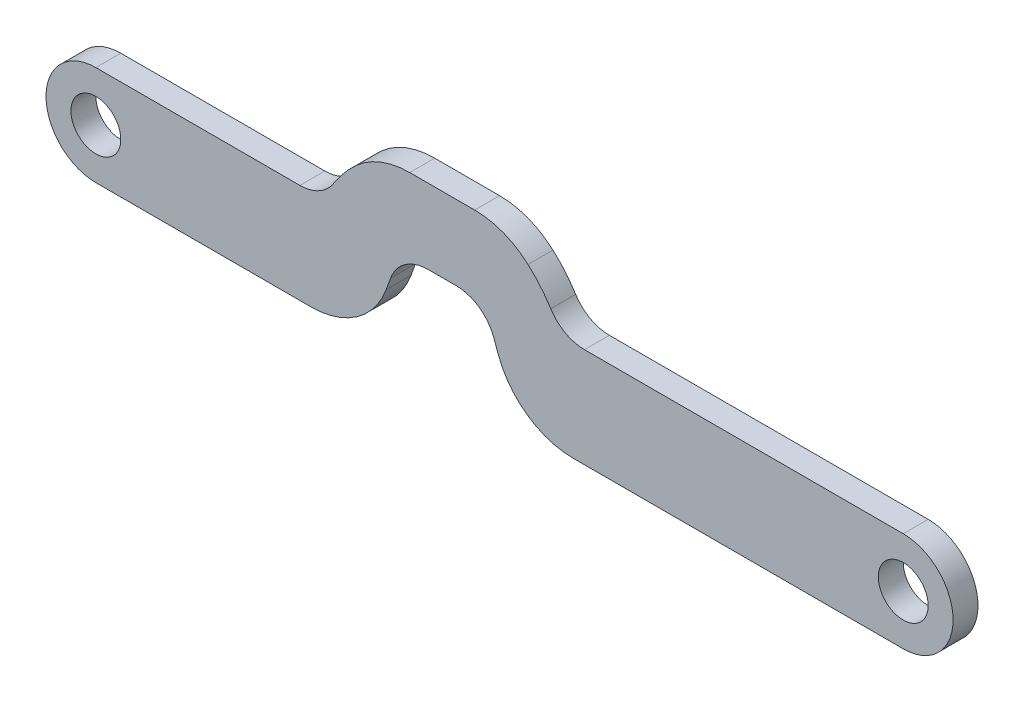
from build123d import *

# Parameters (mm, degrees)
SKETCH_1_R      = 1
EXTRUDE_1_DEPTH = 0.5
EXTRUDE1_DEPTH  = 0.5
EXTRUDE3_DEPTH  = 0.5
FILLET1_R       = 1.6
FILLET2_R       = 1.6
FILLET3_R       = 3.2


with BuildPart() as part:
    # Эскиз1 → Бобышка-Вытянуть1 (new, symmetric)
    with BuildSketch(Plane.XY):
        with BuildLine():
            Line((0, 2), (-32.398, 2))
            ThreePointArc((-32.398, 2), (-34.398, 0), (-32.398, -2))
            Line((-32.398, -2), (0, -2))
            ThreePointArc((0, -2), (2, 0), (0, 2))
        make_face()
        with Locations((-32.398, 0)):
            Circle(SKETCH_1_R, mode=Mode.SUBTRACT)
        Circle(SKETCH_1_R, mode=Mode.SUBTRACT)
    extrude(amount=EXTRUDE_1_DEPTH, both=True)

    # Sketch3 → Extrude1 (add, symmetric)
    with BuildSketch(Plane.XY):
        with BuildLine():
            Line((-18.5, 0), (-16.35, 0))
            ThreePointArc((-16.35, 0), (-16.382663331, 0.373343582), (-16.479660865, 0.735343308))
            Line((-16.479660865, 0.735343308), (-16.212017789, 0))
            Line((-16.212017789, 0), (-13.35, 0))
            ThreePointArc((-13.35, 0), (-14.145547625, 2.749771721), (-16.286405638, 4.65))
            Line((-16.286405638, 4.65), (-20.713594362, 4.65))
            ThreePointArc((-20.713594362, 4.65), (-23.31288628, 1.832655357), (-23.245787606, -2))
            Line((-23.245787606, -2), (-21.515922679, -2))
            Line((-21.515922679, -2), (-20.520339135, 0.735343308))
            ThreePointArc((-20.520339135, 0.735343308), (-20.460511069, -0.882551045), (-19.288986692, -2))
            Line((-19.288986692, -2), (-18.5, -2))
            Line((-18.5, -2), (-18.5, 0))
        make_face()
    extrude(amount=EXTRUDE1_DEPTH, both=True)

    # Sketch → Extrude3 (cut, symmetric)
    with BuildSketch(Plane.XY):
        with BuildLine():
            Line((-15.484077321, -2), (-16.479660865, 0.735343308))
            ThreePointArc((-16.479660865, 0.735343308), (-16.740166364, 1.235105491), (-17.121595125, 1.65))
            Line((-17.121595125, 1.65), (-19.878404875, 1.65))
            ThreePointArc((-19.878404875, 1.65), (-20.259833636, 1.235105491), (-20.520339135, 0.735343308))
            Line((-20.520339135, 0.735343308), (-21.515922679, -2))
            Line((-21.515922679, -2), (-15.484077321, -2))
        make_face()
    extrude(amount=EXTRUDE3_DEPTH, both=True, mode=Mode.SUBTRACT)

    # Fillet1
    fillet1_edges = [part.edges().sort_by_distance(p)[0] for p in [
        (-17.121595125, 1.65, 0),
        (-19.878404875, 1.65, 0),
    ]]
    fillet(fillet1_edges, radius=FILLET1_R)

    # Fillet2
    fillet2_edges = [part.edges().sort_by_distance(p)[0] for p in [
        (-13.754212394, 2, 0),
        (-23.245787606, 2, 0),
    ]]
    fillet(fillet2_edges, radius=FILLET2_R)

    # Fillet3
    fillet3_edges = [part.edges().sort_by_distance(p)[0] for p in [
        (-15.484077321, -2, 0),
        (-21.515922679, -2, 0),
        (-16.286405638, 4.65, 0),
        (-20.713594362, 4.65, 0),
    ]]
    fillet(fillet3_edges, radius=FILLET3_R)


solid = part.part
